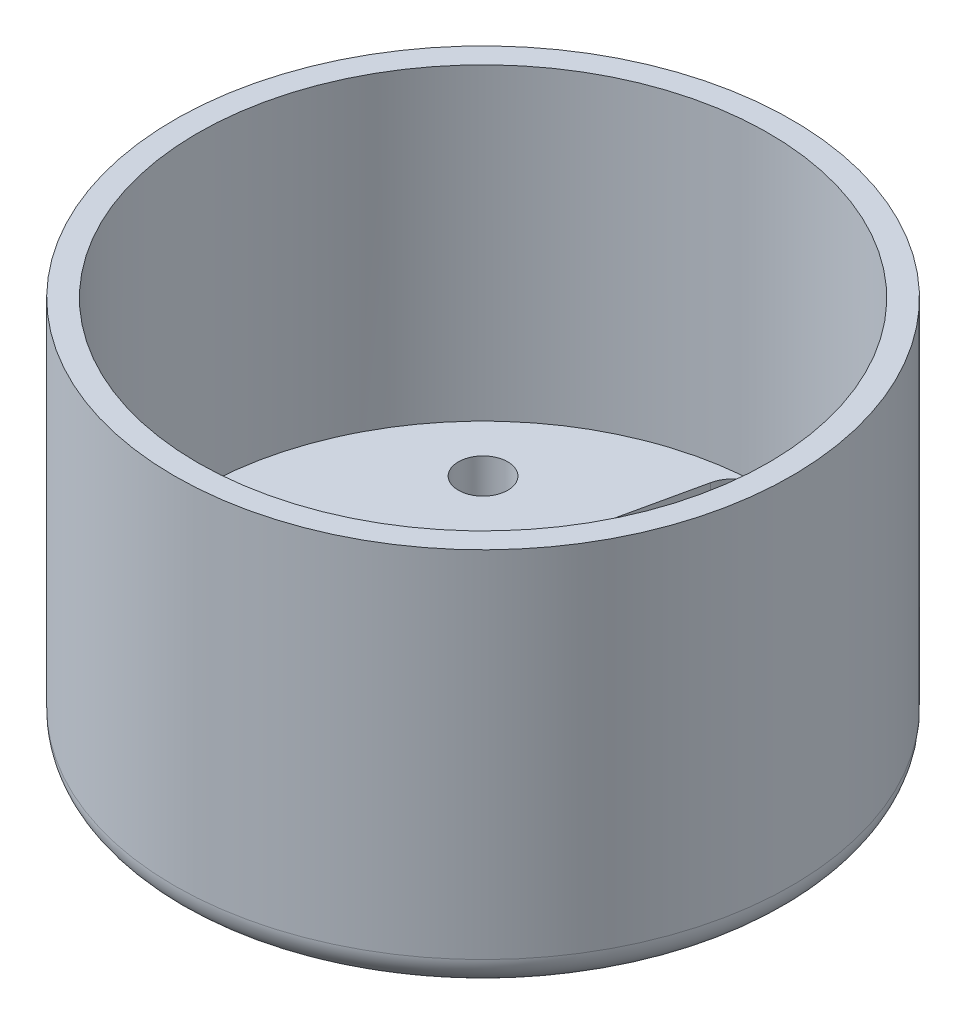
from build123d import *

# Parameters (mm, degrees)
SKETCH_1_R          = 20
SKETCH_1_R_2        = 4.7
EXTRUDE_1_DEPTH     = 2.5
SKETCH_2_R          = 20
EXTRUDE_2_DEPTH     = 2.5
FILLET_1_R          = 5
SKETCH_3_R          = 20
SKETCH_3_R_2        = 18.500135374
EXTRUDE_3_DEPTH     = 20
CUT_EXTRUDE_1_DEPTH = 2.6
SKETCH_5_R          = 1.6
CUT_EXTRUDE_2_DEPTH = 2.6
FILLET_2_R          = 2


with BuildPart() as part:
    # 草图1 → 凸台-拉伸1 (new body)
    with BuildSketch(Plane(origin=(0, 0, 0), x_dir=(1, 0, 0), z_dir=(0, 1, 0))):
        Circle(SKETCH_1_R)
        Circle(SKETCH_1_R_2, mode=Mode.SUBTRACT)
    extrude(amount=EXTRUDE_1_DEPTH)

    # 草图2 → 凸台-拉伸2 (add)
    with BuildSketch(Plane(origin=(0, 2.5, 0), x_dir=(1, 0, 0), z_dir=(0, 1, 0))):
        Circle(SKETCH_2_R)
        with BuildLine():
            Line((-1.563432113, -17.075590083), (-4.71068404, -4.96235635))
            Line((-4.71068404, -4.96235635), (-17.004080234, -2.254434443))
            ThreePointArc((-17.004080234, -2.254434443), (-18.064494297, -1.603755329), (-18.494985714, -0.436477113))
            Line((-18.494985714, -0.436477113), (-18.496384796, -0.365717778))
            Line((-18.496384796, -0.365717778), (-18.497425733, -0.313071754))
            ThreePointArc((-18.497425733, -0.313071754), (-18.11217817, 0.871942042), (-17.075590083, 1.563432113))
            Line((-17.075590083, 1.563432113), (-4.96235635, 4.71068404))
            Line((-4.96235635, 4.71068404), (-2.254434443, 17.004080234))
            ThreePointArc((-2.254434443, 17.004080234), (-1.616612902, 18.053855023), (-0.469840502, 18.494032819))
            ThreePointArc((-0.469840502, 18.494032819), (-0.417780795, 18.49528208), (-0.365717778, 18.496384796))
            Line((-0.365717778, 18.496384796), (-0.313071754, 18.497425733))
            ThreePointArc((-0.313071754, 18.497425733), (0.871942042, 18.11217817), (1.563432113, 17.075590083))
            Line((1.563432113, 17.075590083), (4.71068404, 4.96235635))
            Line((4.71068404, 4.96235635), (17.004080234, 2.254434443))
            ThreePointArc((17.004080234, 2.254434443), (18.053855023, 1.616612902), (18.494032819, 0.469840502))
            ThreePointArc((18.494032819, 0.469840502), (18.49528208, 0.417780795), (18.496384796, 0.365717778))
            Line((18.496384796, 0.365717778), (18.497425733, 0.313071754))
            ThreePointArc((18.497425733, 0.313071754), (18.11217817, -0.871942042), (17.075590083, -1.563432113))
            Line((17.075590083, -1.563432113), (4.96235635, -4.71068404))
            Line((4.96235635, -4.71068404), (2.254434443, -17.004080234))
            ThreePointArc((2.254434443, -17.004080234), (1.616612902, -18.053855023), (0.469840502, -18.494032819))
            ThreePointArc((0.469840502, -18.494032819), (0.417780795, -18.49528208), (0.365717778, -18.496384796))
            Line((0.365717778, -18.496384796), (0.313071754, -18.497425733))
            ThreePointArc((0.313071754, -18.497425733), (-0.871942042, -18.11217817), (-1.563432113, -17.075590083))
        make_face(mode=Mode.SUBTRACT)
    extrude(amount=EXTRUDE_2_DEPTH)

    # 圆角1
    fillet_1_edges = [part.edges().sort_by_distance(p)[0] for p in [
        (-4.71068404, 3.75, 4.96235635),
        (-4.96235635, 3.75, -4.71068404),
        (4.96235635, 3.75, 4.71068404),
        (4.71068404, 3.75, -4.96235635),
    ]]
    fillet(fillet_1_edges, radius=FILLET_1_R)

    # 草图3 → 凸台-拉伸3 (add)
    with BuildSketch(Plane(origin=(0, 5, 0), x_dir=(1, 0, 0), z_dir=(0, 1, 0))):
        Circle(SKETCH_3_R)
        Circle(SKETCH_3_R_2, mode=Mode.SUBTRACT)
    extrude(amount=EXTRUDE_3_DEPTH)

    # 草图4 → 切除-拉伸1 (cut)
    with BuildSketch(Plane.XZ):
        Polygon((-7.1, -11.674315781), (-7.1, -8.325684219), (-10, -6.651368439), (-12.9, -8.325684219), (-12.9, -11.674315781), (-10, -13.348631561), align=None)
        Polygon((-11.674315781, 7.1), (-8.325684219, 7.1), (-6.651368439, 10), (-8.325684219, 12.9), (-11.674315781, 12.9), (-13.348631561, 10), align=None)
        Polygon((8.325684219, -7.1), (6.651368439, -10), (8.325684219, -12.9), (11.674315781, -12.9), (13.348631561, -10), (11.674315781, -7.1), align=None)
        Polygon((7.1, 11.674315781), (7.1, 8.325684219), (10, 6.651368439), (12.9, 8.325684219), (12.9, 11.674315781), (10, 13.348631561), align=None)
    extrude(amount=-CUT_EXTRUDE_1_DEPTH, mode=Mode.SUBTRACT)

    # 草图5 → 切除-拉伸2 (cut)
    with BuildSketch(Plane.XZ.offset(-2.6)):
        with Locations((10, -10)):
            Circle(SKETCH_5_R)
        with Locations((-10, -10)):
            Circle(SKETCH_5_R)
        with Locations((-10, 10)):
            Circle(SKETCH_5_R)
        with Locations((10, 10)):
            Circle(SKETCH_5_R)
    extrude(amount=-CUT_EXTRUDE_2_DEPTH, mode=Mode.SUBTRACT)

    # 圆角2
    fillet_2_edges = [part.edges().sort_by_distance(p)[0] for p in [
        (-20, 0, 0),
    ]]
    fillet(fillet_2_edges, radius=FILLET_2_R)


solid = part.part
